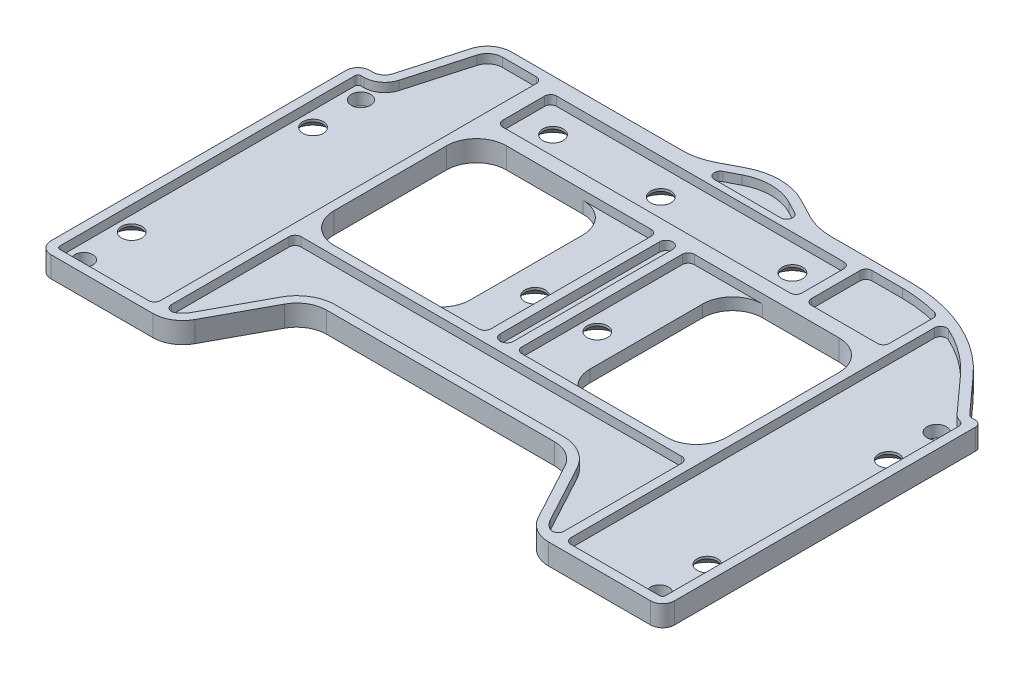
from build123d import *

# Parameters (mm, degrees)
SKETCH_1_R                = 1.5
SKETCH_1_R_2              = 1.605603054
SKETCH_1_W                = 22.8
SKETCH_1_H                = 28.8
EXTRUDE_1_DEPTH           = 3.5
FILLET_1_R                = 10
FILLET_2_R                = 25
FILLET_3_R                = 1
FILLET_4_R                = 2
FILLET_5_R                = 2
FILLET_6_R                = 5
FILLET_7_R                = 5
FILLET_8_R                = 4
SKETCH_2_W                = 50
SKETCH_2_H                = 9
CUT_EXTRUDE_1_DEPTH       = 1.5
FILLET_START              = 2
FILLET_9_DEPTH            = 1.5
HOLE_WIZARD_1_D           = 3.4
HOLE_WIZARD_1_CSINK_D     = 6.6
HOLE_WIZARD_1_CSINK_ANGLE = 90


with BuildPart() as part:
    # 草图1 → 凸台-拉伸1 (new body)
    with BuildSketch(Plane(origin=(0, 0, 0), x_dir=(1, 0, 0), z_dir=(0, 1, 0))):
        Polygon((22, 15), (-22, 15), (-30.1, 0), (-52.1, 0), (-52.1, 53.3), (-48.1, 53.3), (-44, 67.8), (-10, 67.8), (0, 73), (10, 67.8), (37, 67.8), (50.1, 53.3), (52.1, 53.3), (52.1, 0), (30.1, 0), align=None)
        with Locations(Location((-27, 60.8, 0), (0, 0, 270))):
            Circle(SKETCH_1_R, mode=Mode.SUBTRACT)
        with Locations(Location((-9, 60.8, 0), (0, 0, 270))):
            Circle(SKETCH_1_R, mode=Mode.SUBTRACT)
        with Locations(Location((13, 60.8, 0), (0, 0, 270))):
            Circle(SKETCH_1_R, mode=Mode.SUBTRACT)
        with Locations(Location((-5.2, 36, 0), (0, 0, 270))):
            Circle(SKETCH_1_R, mode=Mode.SUBTRACT)
        with Locations(Location((5.2, 36, 0), (0, 0, 90))):
            Circle(SKETCH_1_R, mode=Mode.SUBTRACT)
        with Locations(Location((-48.1, 3.5, 0), (0, 0, 270))):
            Circle(SKETCH_1_R, mode=Mode.SUBTRACT)
        with Locations(Location((-48.1, 11.5, 0), (0, 0, 270))):
            Circle(SKETCH_1_R, mode=Mode.SUBTRACT)
        with Locations(Location((-48.1, 41.8, 0), (0, 0, 270))):
            Circle(SKETCH_1_R, mode=Mode.SUBTRACT)
        with Locations(Location((-48.1, 49.8, 0), (0, 0, 270))):
            Circle(SKETCH_1_R_2, mode=Mode.SUBTRACT)
        with Locations(Location((48.1, 11.5, 0), (0, 0, 90))):
            Circle(SKETCH_1_R, mode=Mode.SUBTRACT)
        with Locations(Location((48.1, 3.5, 0), (0, 0, 90))):
            Circle(SKETCH_1_R, mode=Mode.SUBTRACT)
        with Locations(Location((48.1, 49.8, 0), (0, 0, 90))):
            Circle(SKETCH_1_R_2, mode=Mode.SUBTRACT)
        with Locations(Location((48.1, 41.8, 0), (0, 0, 90))):
            Circle(SKETCH_1_R, mode=Mode.SUBTRACT)
        with Locations((21.4, 39.4)):
            Rectangle(SKETCH_1_W, SKETCH_1_H, mode=Mode.SUBTRACT)
        with Locations((-21.4, 39.4)):
            Rectangle(SKETCH_1_W, SKETCH_1_H, mode=Mode.SUBTRACT)
    extrude(amount=EXTRUDE_1_DEPTH)

    # 圆角1
    fillet_1_edges = [part.edges().sort_by_distance(p)[0] for p in [
        (10, 1.75, -67.8),
        (-10, 1.75, -67.8),
        (0, 1.75, -73),
    ]]
    fillet(fillet_1_edges, radius=FILLET_1_R)

    # 圆角2
    fillet_2_edges = [part.edges().sort_by_distance(p)[0] for p in [
        (37, 1.75, -67.8),
    ]]
    fillet(fillet_2_edges, radius=FILLET_2_R)

    # 圆角3
    fillet_3_edges = [part.edges().sort_by_distance(p)[0] for p in [
        (50.1, 1.75, -53.3),
        (52.1, 1.75, -53.3),
    ]]
    fillet(fillet_3_edges, radius=FILLET_3_R)

    # 圆角4
    fillet_4_edges = [part.edges().sort_by_distance(p)[0] for p in [
        (52.1, 1.75, 0),
        (-52.1, 1.75, 0),
    ]]
    fillet(fillet_4_edges, radius=FILLET_4_R)

    # 圆角5
    fillet_5_edges = [part.edges().sort_by_distance(p)[0] for p in [
        (-52.1, 1.75, -53.3),
        (-48.1, 1.75, -53.3),
    ]]
    fillet(fillet_5_edges, radius=FILLET_5_R)

    # 圆角6
    fillet_6_edges = [part.edges().sort_by_distance(p)[0] for p in [
        (-32.8, 1.75, -53.8),
        (-32.8, 1.75, -25),
        (-10, 1.75, -25),
        (-10, 1.75, -53.8),
        (32.8, 1.75, -53.8),
        (10, 1.75, -53.8),
        (10, 1.75, -25),
        (32.8, 1.75, -25),
    ]]
    fillet(fillet_6_edges, radius=FILLET_6_R)

    # 圆角7
    fillet_7_edges = [part.edges().sort_by_distance(p)[0] for p in [
        (30.1, 1.75, 0),
        (22, 1.75, -15),
        (-22, 1.75, -15),
        (-30.1, 1.75, 0),
    ]]
    fillet(fillet_7_edges, radius=FILLET_7_R)

    # 圆角8
    fillet_8_edges = [part.edges().sort_by_distance(p)[0] for p in [
        (-44, 1.75, -67.8),
    ]]
    fillet(fillet_8_edges, radius=FILLET_8_R)

    # 草图2 → 切除-拉伸1 (cut)
    with BuildSketch(Plane(origin=(0, 3.5, 0), x_dir=(1, 0, 0), z_dir=(0, 1, 0))):
        with BuildLine():
            Line((-50.6, 51.3), (-50.6, 2))
            ThreePointArc((-50.6, 2), (-50.453553391, 1.646446609), (-50.1, 1.5))
            Line((-50.1, 1.5), (-34.3, 1.5))
            Line((-34.3, 1.5), (-34.3, 66.3))
            Line((-34.3, 66.3), (-40.97420408, 66.3))
            ThreePointArc((-40.97420408, 66.3), (-42.482420533, 65.793811207), (-43.379883174, 64.480226503))
            Line((-43.379883174, 64.480226503), (-46.244947228, 54.347682896))
            ThreePointArc((-46.244947228, 54.347682896), (-47.501394925, 52.508664311), (-49.61289796, 51.8))
            Line((-49.61289796, 51.8), (-50.1, 51.8))
            ThreePointArc((-50.1, 51.8), (-50.453553391, 51.653553391), (-50.6, 51.3))
        make_face()
        with BuildLine():
            Line((24.736956027, 13.088467946), (30.002760166, 3.336978798))
            ThreePointArc((30.002760166, 3.336978798), (31.16955228, 2.068975873), (32.8, 1.511413778))
            Line((32.8, 1.511413778), (32.8, 23.5))
            Line((32.8, 23.5), (-32.8, 23.5))
            Line((-32.8, 23.5), (-32.8, 1.511413778))
            ThreePointArc((-32.8, 1.511413778), (-31.16955228, 2.068975873), (-30.002760166, 3.336978798))
            Line((-30.002760166, 3.336978798), (-24.736956027, 13.088467946))
            ThreePointArc((-24.736956027, 13.088467946), (-22.347357598, 15.582340085), (-19.017570942, 16.5))
            Line((-19.017570942, 16.5), (19.017570942, 16.5))
            ThreePointArc((19.017570942, 16.5), (22.347357598, 15.582340085), (24.736956027, 13.088467946))
        make_face()
        with BuildLine():
            Line((-32.8, 48.8), (-32.8, 30))
            ThreePointArc((-32.8, 30), (-31.335533906, 26.464466094), (-27.8, 25))
            Line((-27.8, 25), (-2.6, 25))
            Line((-2.6, 25), (-2.6, 53.8))
            Line((-2.6, 53.8), (-27.8, 53.8))
            ThreePointArc((-27.8, 53.8), (-31.335533906, 52.335533906), (-32.8, 48.8))
        make_face()
        with BuildLine():
            Line((15, 25), (27.8, 25))
            ThreePointArc((27.8, 25), (31.335533906, 26.464466094), (32.8, 30))
            Line((32.8, 30), (32.8, 48.8))
            ThreePointArc((32.8, 48.8), (31.335533906, 52.335533906), (27.8, 53.8))
            Line((27.8, 53.8), (15, 53.8))
            Line((15, 53.8), (2.6, 53.8))
            Line((2.6, 53.8), (2.6, 25))
            Line((2.6, 25), (15, 25))
        make_face()
        with BuildLine():
            Line((-1.1, 52.7), (-1.1, 26.1))
            ThreePointArc((-1.1, 26.1), (0, 25), (1.1, 26.1))
            Line((1.1, 26.1), (1.1, 52.7))
            ThreePointArc((1.1, 52.7), (0, 53.8), (-1.1, 52.7))
        make_face()
        with Locations((-6.8, 60.7)):
            Rectangle(SKETCH_2_W, SKETCH_2_H)
        with BuildLine():
            Line((32.8, 56.2), (32.8, 65.262477961))
            ThreePointArc((32.8, 65.262477961), (29.385961111, 66.039172017), (25.894416473, 66.3))
            Line((25.894416473, 66.3), (19.8, 66.3))
            Line((19.8, 66.3), (19.8, 56.2))
            Line((19.8, 56.2), (32.8, 56.2))
        make_face()
        with BuildLine():
            ThreePointArc((-12.444619698, 66.3), (-9.71372442, 66.628956585), (-7.139063226, 67.597006786))
            Line((-7.139063226, 67.597006786), (-3.921498261, 69.270140568))
            ThreePointArc((-3.921498261, 69.270140568), (0, 70.228797757), (3.921498261, 69.270140568))
            Line((3.921498261, 69.270140568), (7.139063226, 67.597006786))
            ThreePointArc((7.139063226, 67.597006786), (9.71372442, 66.628956585), (12.444619698, 66.3))
            Line((12.444619698, 66.3), (-12.444619698, 66.3))
        make_face()
        with BuildLine():
            Line((48.68917203, 52.624057091), (43.331898797, 58.553863341))
            ThreePointArc((43.331898797, 58.553863341), (39.181608925, 62.182995556), (34.3, 64.745299396))
            Line((34.3, 64.745299396), (34.3, 1.5))
            Line((34.3, 1.5), (50.1, 1.5))
            ThreePointArc((50.1, 1.5), (50.453553391, 1.646446609), (50.6, 2))
            Line((50.6, 2), (50.6, 51.8))
            Line((50.6, 51.8), (50.544223341, 51.8))
            ThreePointArc((50.544223341, 51.8), (49.529299027, 52.015283686), (48.68917203, 52.624057091))
        make_face()
    extrude(amount=-CUT_EXTRUDE_1_DEPTH, mode=Mode.SUBTRACT)

    # 圆角9: read off the stored shape, not the designer's step
    # 圆角9 outline → 圆角9 (add)
    with BuildSketch(Plane(origin=(0, 0, 0), x_dir=(1, 0, 0), z_dir=(0, 1, 0)).offset(FILLET_START)):
        with BuildLine():
            Line((7.139063226, 67.597006786), (6.004043966, 68.187216801))
            ThreePointArc((6.004043966, 68.187216801), (6.514086309, 67.062530845), (5.542691229, 66.3))
            Line((5.542691229, 66.3), (12.444619698, 66.3))
            ThreePointArc((12.444619698, 66.3), (9.71372442, 66.628956585), (7.139063226, 67.597006786))
        make_face()
        with BuildLine():
            Line((-12.444619698, 66.3), (-5.542691229, 66.3))
            ThreePointArc((-5.542691229, 66.3), (-6.514086309, 67.062530845), (-6.004043966, 68.187216801))
            Line((-6.004043966, 68.187216801), (-7.139063226, 67.597006786))
            ThreePointArc((-7.139063226, 67.597006786), (-9.71372442, 66.628956585), (-12.444619698, 66.3))
        make_face()
        with BuildLine():
            ThreePointArc((32.062470379, 65.476091176), (32.594503108, 65.118411211), (32.8, 64.511151126))
            Line((32.8, 64.511151126), (32.8, 65.262477961))
            ThreePointArc((32.8, 65.262477961), (32.4321077, 65.372297034), (32.062470379, 65.476091176))
        make_face()
        with BuildLine():
            Line((32.8, 56.2), (32.8, 57.2))
            ThreePointArc((32.8, 57.2), (32.507106781, 56.492893219), (31.8, 56.2))
            Line((31.8, 56.2), (32.8, 56.2))
        make_face()
        with BuildLine():
            ThreePointArc((19.8, 65.3), (20.092893219, 66.007106781), (20.8, 66.3))
            Line((20.8, 66.3), (19.8, 66.3))
            Line((19.8, 66.3), (19.8, 65.3))
        make_face()
        with BuildLine():
            Line((19.8, 56.2), (20.8, 56.2))
            ThreePointArc((20.8, 56.2), (20.092893219, 56.492893219), (19.8, 57.2))
            Line((19.8, 57.2), (19.8, 56.2))
        make_face()
        with BuildLine():
            Line((18.2, 56.2), (18.2, 57.2))
            ThreePointArc((18.2, 57.2), (17.907106781, 56.492893219), (17.2, 56.2))
            Line((17.2, 56.2), (18.2, 56.2))
        make_face()
        with BuildLine():
            ThreePointArc((17.2, 65.2), (17.907106781, 64.907106781), (18.2, 64.2))
            Line((18.2, 64.2), (18.2, 65.2))
            Line((18.2, 65.2), (17.2, 65.2))
        make_face()
        with BuildLine():
            Line((-31.8, 56.2), (-30.8, 56.2))
            ThreePointArc((-30.8, 56.2), (-31.507106781, 56.492893219), (-31.8, 57.2))
            Line((-31.8, 57.2), (-31.8, 56.2))
        make_face()
        with BuildLine():
            ThreePointArc((-31.8, 64.2), (-31.507106781, 64.907106781), (-30.8, 65.2))
            Line((-30.8, 65.2), (-31.8, 65.2))
            Line((-31.8, 65.2), (-31.8, 64.2))
        make_face()
        with BuildLine():
            ThreePointArc((3.6, 25), (2.892893219, 25.292893219), (2.6, 26))
            Line((2.6, 26), (2.6, 25))
            Line((2.6, 25), (3.6, 25))
        make_face()
        with BuildLine():
            ThreePointArc((2.6, 52.8), (2.892893219, 53.507106781), (3.6, 53.8))
            Line((3.6, 53.8), (2.6, 53.8))
            Line((2.6, 53.8), (2.6, 52.8))
        make_face()
        with BuildLine():
            Line((-2.6, 25), (-2.6, 26))
            ThreePointArc((-2.6, 26), (-2.892893219, 25.292893219), (-3.6, 25))
            Line((-3.6, 25), (-2.6, 25))
        make_face()
        with BuildLine():
            ThreePointArc((-3.6, 53.8), (-2.892893219, 53.507106781), (-2.6, 52.8))
            Line((-2.6, 52.8), (-2.6, 53.8))
            Line((-2.6, 53.8), (-3.6, 53.8))
        make_face()
        with BuildLine():
            ThreePointArc((-31.287028377, 1.995580523), (-32.293471568, 1.98422416), (-32.8, 2.853986088))
            Line((-32.8, 2.853986088), (-32.8, 1.511413778))
            ThreePointArc((-32.8, 1.511413778), (-32.015682385, 1.666525606), (-31.287028377, 1.995580523))
        make_face()
        with BuildLine():
            ThreePointArc((-32.8, 22.5), (-32.507106781, 23.207106781), (-31.8, 23.5))
            Line((-31.8, 23.5), (-32.8, 23.5))
            Line((-32.8, 23.5), (-32.8, 22.5))
        make_face()
        with BuildLine():
            ThreePointArc((31.8, 23.5), (32.507106781, 23.207106781), (32.8, 22.5))
            Line((32.8, 22.5), (32.8, 23.5))
            Line((32.8, 23.5), (31.8, 23.5))
        make_face()
        with BuildLine():
            ThreePointArc((32.8, 2.853986088), (32.293471568, 1.98422416), (31.287028377, 1.995580523))
            ThreePointArc((31.287028377, 1.995580523), (32.015682385, 1.666525606), (32.8, 1.511413778))
            Line((32.8, 1.511413778), (32.8, 2.853986088))
        make_face()
        with BuildLine():
            ThreePointArc((-35.3, 66.3), (-34.592893219, 66.007106781), (-34.3, 65.3))
            Line((-34.3, 65.3), (-34.3, 66.3))
            Line((-34.3, 66.3), (-35.3, 66.3))
        make_face()
        with BuildLine():
            ThreePointArc((-34.3, 2.5), (-34.592893219, 1.792893219), (-35.3, 1.5))
            Line((-35.3, 1.5), (-34.3, 1.5))
            Line((-34.3, 1.5), (-34.3, 2.5))
        make_face()
        with BuildLine():
            ThreePointArc((35.3, 1.5), (34.592893219, 1.792893219), (34.3, 2.5))
            Line((34.3, 2.5), (34.3, 1.5))
            Line((34.3, 1.5), (35.3, 1.5))
        make_face()
        with BuildLine():
            ThreePointArc((34.3, 63.239789591), (34.760567861, 64.081818668), (35.718025935, 64.148224684))
            ThreePointArc((35.718025935, 64.148224684), (35.013900768, 64.458370349), (34.3, 64.745299396))
            Line((34.3, 64.745299396), (34.3, 63.239789591))
        make_face()
        with BuildLine():
            ThreePointArc((49.869778097, 51.892693702), (50.396799252, 51.534015298), (50.6, 50.929771183))
            Line((50.6, 50.929771183), (50.6, 51.8))
            Line((50.6, 51.8), (50.544223341, 51.8))
            ThreePointArc((50.544223341, 51.8), (50.203830733, 51.823281834), (49.869778097, 51.892693702))
        make_face()
    extrude(amount=FILLET_9_DEPTH)

    # 打孔尺寸(%根据)开槽半沉头木螺钉的类型1 (through all)
    with Locations(Plane(origin=(0, 0, 0), x_dir=(-1, 0, 0), z_dir=(0, -1, 0))):
        with Locations((48.1, 11.5), (48.1, 41.8), (5.2, 36), (-5.2, 36), (27, 60.8), (9, 60.8), (-13, 60.8), (-48.1, 41.8), (-48.1, 11.5)):
            CounterSinkHole(HOLE_WIZARD_1_D / 2, HOLE_WIZARD_1_CSINK_D / 2, counter_sink_angle=HOLE_WIZARD_1_CSINK_ANGLE)


solid = part.part
